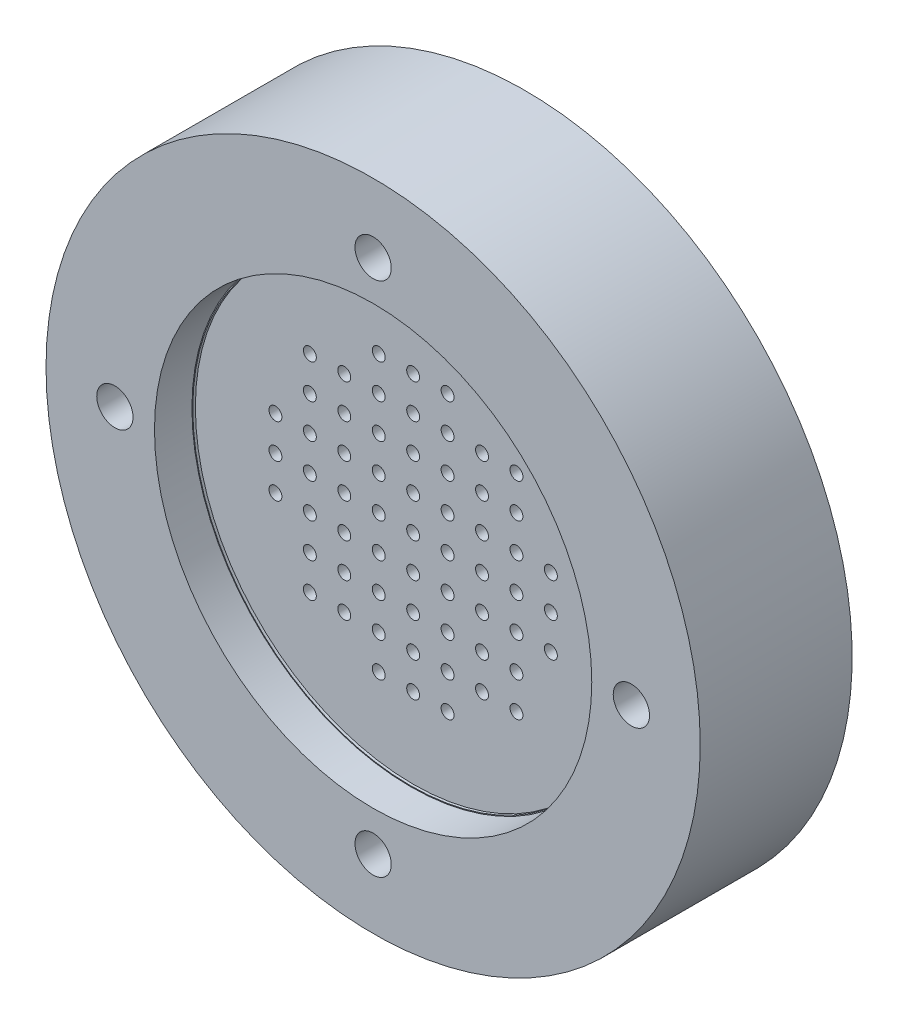
from build123d import *

# Parameters (mm, degrees)
SKETCH1_R                                  = 38
BOSS_EXTRUDE1_DEPTH                        = 5
SKETCH2_R                                  = 0.75
CUT_EXTRUDE1_DEPTH                         = 54.972215074
LPATTERN1_COUNT                            = 5
LPATTERN1_PITCH                            = 4
LPATTERN1_COUNT_DIR2                       = 5
LPATTERN1_PITCH_DIR2                       = 4
MIRROR1_COPY_1_SKETCH_R                    = 0.75
MIRROR1_COPY_1_DEPTH                       = 54.972215074
MIRROR1_COPY_2_SKETCH_R                    = 0.75
MIRROR1_COPY_2_DEPTH                       = 54.972215074
MIRROR1_COPY_3_SKETCH_R                    = 0.75
MIRROR1_COPY_3_DEPTH                       = 54.972215074
MIRROR1_COPY_4_SKETCH_R                    = 0.75
MIRROR1_COPY_4_DEPTH                       = 54.972215074
MIRROR1_COPY_5_SKETCH_R                    = 0.75
MIRROR1_COPY_5_DEPTH                       = 54.972215074
MIRROR1_COPY_6_SKETCH_R                    = 0.75
MIRROR1_COPY_6_DEPTH                       = 54.972215074
MIRROR1_COPY_7_SKETCH_R                    = 0.75
MIRROR1_COPY_7_DEPTH                       = 54.972215074
MIRROR1_COPY_8_SKETCH_R                    = 0.75
MIRROR1_COPY_8_DEPTH                       = 54.972215074
MIRROR1_COPY_9_SKETCH_R                    = 0.75
MIRROR1_COPY_9_DEPTH                       = 54.972215074
MIRROR1_COPY_10_SKETCH_R                   = 0.75
MIRROR1_COPY_10_DEPTH                      = 54.972215074
MIRROR1_COPY_11_SKETCH_R                   = 0.75
MIRROR1_COPY_11_DEPTH                      = 54.972215074
MIRROR1_COPY_12_SKETCH_R                   = 0.75
MIRROR1_COPY_12_DEPTH                      = 54.972215074
MIRROR1_COPY_13_SKETCH_R                   = 0.75
MIRROR1_COPY_13_DEPTH                      = 54.972215074
MIRROR1_COPY_14_SKETCH_R                   = 0.75
MIRROR1_COPY_14_DEPTH                      = 54.972215074
MIRROR1_COPY_15_SKETCH_R                   = 0.75
MIRROR1_COPY_15_DEPTH                      = 54.972215074
MIRROR1_COPY_16_SKETCH_R                   = 0.75
MIRROR1_COPY_16_DEPTH                      = 54.972215074
MIRROR1_COPY_17_SKETCH_R                   = 0.75
MIRROR1_COPY_17_DEPTH                      = 54.972215074
MIRROR1_COPY_18_SKETCH_R                   = 0.75
MIRROR1_COPY_18_DEPTH                      = 54.972215074
MIRROR1_COPY_19_SKETCH_R                   = 0.75
MIRROR1_COPY_19_DEPTH                      = 54.972215074
MIRROR1_COPY_20_SKETCH_R                   = 0.75
MIRROR1_COPY_20_DEPTH                      = 54.972215074
MIRROR1_AT_THE_SECOND_PLANE_COPY_1_SKETC_R = 0.75
MIRROR1_AT_THE_SECOND_PLANE_COPY_1_DEPTH   = 54.972215074
MIRROR1_AT_THE_SECOND_PLANE_COPY_2_SKETC_R = 0.75
MIRROR1_AT_THE_SECOND_PLANE_COPY_2_DEPTH   = 54.972215074
MIRROR1_AT_THE_SECOND_PLANE_COPY_3_SKETC_R = 0.75
MIRROR1_AT_THE_SECOND_PLANE_COPY_3_DEPTH   = 54.972215074
MIRROR1_AT_THE_SECOND_PLANE_COPY_4_SKETC_R = 0.75
MIRROR1_AT_THE_SECOND_PLANE_COPY_4_DEPTH   = 54.972215074
MIRROR1_AT_THE_SECOND_PLANE_COPY_5_SKETC_R = 0.75
MIRROR1_AT_THE_SECOND_PLANE_COPY_5_DEPTH   = 54.972215074
MIRROR1_AT_THE_SECOND_PLANE_COPY_6_SKETC_R = 0.75
MIRROR1_AT_THE_SECOND_PLANE_COPY_6_DEPTH   = 54.972215074
MIRROR1_AT_THE_SECOND_PLANE_COPY_7_SKETC_R = 0.75
MIRROR1_AT_THE_SECOND_PLANE_COPY_7_DEPTH   = 54.972215074
MIRROR1_AT_THE_SECOND_PLANE_COPY_8_SKETC_R = 0.75
MIRROR1_AT_THE_SECOND_PLANE_COPY_8_DEPTH   = 54.972215074
MIRROR1_AT_THE_SECOND_PLANE_COPY_9_SKETC_R = 0.75
MIRROR1_AT_THE_SECOND_PLANE_COPY_9_DEPTH   = 54.972215074
MIRROR1_AT_THE_SECOND_PLANE_COPY_10_SKET_R = 0.75
MIRROR1_AT_THE_SECOND_PLANE_COPY_10_DEPTH  = 54.972215074
MIRROR1_AT_THE_SECOND_PLANE_COPY_11_SKET_R = 0.75
MIRROR1_AT_THE_SECOND_PLANE_COPY_11_DEPTH  = 54.972215074
MIRROR1_AT_THE_SECOND_PLANE_COPY_12_SKET_R = 0.75
MIRROR1_AT_THE_SECOND_PLANE_COPY_12_DEPTH  = 54.972215074
MIRROR1_AT_THE_SECOND_PLANE_COPY_13_SKET_R = 0.75
MIRROR1_AT_THE_SECOND_PLANE_COPY_13_DEPTH  = 54.972215074
MIRROR1_AT_THE_SECOND_PLANE_COPY_14_SKET_R = 0.75
MIRROR1_AT_THE_SECOND_PLANE_COPY_14_DEPTH  = 54.972215074
MIRROR1_AT_THE_SECOND_PLANE_COPY_15_SKET_R = 0.75
MIRROR1_AT_THE_SECOND_PLANE_COPY_15_DEPTH  = 54.972215074
MIRROR1_AT_THE_SECOND_PLANE_COPY_16_SKET_R = 0.75
MIRROR1_AT_THE_SECOND_PLANE_COPY_16_DEPTH  = 54.972215074
MIRROR1_AT_THE_SECOND_PLANE_COPY_17_SKET_R = 0.75
MIRROR1_AT_THE_SECOND_PLANE_COPY_17_DEPTH  = 54.972215074
MIRROR1_AT_THE_SECOND_PLANE_COPY_18_SKET_R = 0.75
MIRROR1_AT_THE_SECOND_PLANE_COPY_18_DEPTH  = 54.972215074
MIRROR1_AT_THE_SECOND_PLANE_COPY_19_SKET_R = 0.75
MIRROR1_AT_THE_SECOND_PLANE_COPY_19_DEPTH  = 54.972215074
MIRROR1_AT_THE_SECOND_PLANE_COPY_20_SKET_R = 0.75
MIRROR1_AT_THE_SECOND_PLANE_COPY_20_DEPTH  = 54.972215074
MIRROR1_AT_THE_SECOND_PLANE_COPY_21_SKET_R = 0.75
MIRROR1_AT_THE_SECOND_PLANE_COPY_21_DEPTH  = 54.972215074
MIRROR1_AT_THE_SECOND_PLANE_COPY_22_SKET_R = 0.75
MIRROR1_AT_THE_SECOND_PLANE_COPY_22_DEPTH  = 54.972215074
MIRROR1_AT_THE_SECOND_PLANE_COPY_23_SKET_R = 0.75
MIRROR1_AT_THE_SECOND_PLANE_COPY_23_DEPTH  = 54.972215074
MIRROR1_AT_THE_SECOND_PLANE_COPY_24_SKET_R = 0.75
MIRROR1_AT_THE_SECOND_PLANE_COPY_24_DEPTH  = 54.972215074
MIRROR1_AT_THE_SECOND_PLANE_COPY_25_SKET_R = 0.75
MIRROR1_AT_THE_SECOND_PLANE_COPY_25_DEPTH  = 54.972215074
MIRROR1_AT_THE_SECOND_PLANE_COPY_26_SKET_R = 0.75
MIRROR1_AT_THE_SECOND_PLANE_COPY_26_DEPTH  = 54.972215074
MIRROR1_AT_THE_SECOND_PLANE_COPY_27_SKET_R = 0.75
MIRROR1_AT_THE_SECOND_PLANE_COPY_27_DEPTH  = 54.972215074
MIRROR1_AT_THE_SECOND_PLANE_COPY_28_SKET_R = 0.75
MIRROR1_AT_THE_SECOND_PLANE_COPY_28_DEPTH  = 54.972215074
MIRROR1_AT_THE_SECOND_PLANE_COPY_29_SKET_R = 0.75
MIRROR1_AT_THE_SECOND_PLANE_COPY_29_DEPTH  = 54.972215074
MIRROR1_AT_THE_SECOND_PLANE_COPY_30_SKET_R = 0.75
MIRROR1_AT_THE_SECOND_PLANE_COPY_30_DEPTH  = 54.972215074
MIRROR1_AT_THE_SECOND_PLANE_COPY_31_SKET_R = 0.75
MIRROR1_AT_THE_SECOND_PLANE_COPY_31_DEPTH  = 54.972215074
MIRROR1_AT_THE_SECOND_PLANE_COPY_32_SKET_R = 0.75
MIRROR1_AT_THE_SECOND_PLANE_COPY_32_DEPTH  = 54.972215074
MIRROR1_AT_THE_SECOND_PLANE_COPY_33_SKET_R = 0.75
MIRROR1_AT_THE_SECOND_PLANE_COPY_33_DEPTH  = 54.972215074
MIRROR1_AT_THE_SECOND_PLANE_COPY_34_SKET_R = 0.75
MIRROR1_AT_THE_SECOND_PLANE_COPY_34_DEPTH  = 54.972215074
MIRROR1_AT_THE_SECOND_PLANE_COPY_35_SKET_R = 0.75
MIRROR1_AT_THE_SECOND_PLANE_COPY_35_DEPTH  = 54.972215074
MIRROR1_AT_THE_SECOND_PLANE_COPY_36_SKET_R = 0.75
MIRROR1_AT_THE_SECOND_PLANE_COPY_36_DEPTH  = 54.972215074
MIRROR1_AT_THE_SECOND_PLANE_COPY_37_SKET_R = 0.75
MIRROR1_AT_THE_SECOND_PLANE_COPY_37_DEPTH  = 54.972215074
MIRROR1_AT_THE_SECOND_PLANE_COPY_38_SKET_R = 0.75
MIRROR1_AT_THE_SECOND_PLANE_COPY_38_DEPTH  = 54.972215074
MIRROR1_AT_THE_SECOND_PLANE_COPY_39_SKET_R = 0.75
MIRROR1_AT_THE_SECOND_PLANE_COPY_39_DEPTH  = 54.972215074
MIRROR1_AT_THE_SECOND_PLANE_COPY_40_SKET_R = 0.75
MIRROR1_AT_THE_SECOND_PLANE_COPY_40_DEPTH  = 54.972215074
MIRROR1_AT_THE_SECOND_PLANE_COPY_41_SKET_R = 0.75
MIRROR1_AT_THE_SECOND_PLANE_COPY_41_DEPTH  = 54.972215074
SKETCH16_R                                 = 38
SKETCH16_R_2                               = 25.4
BOSS_EXTRUDE2_DEPTH                        = 4.65
BOSS_EXTRUDE3_START                        = 8
SKETCH17_R                                 = 38
SKETCH17_R_2                               = 33
BOSS_EXTRUDE3_DEPTH                        = 8
HOLE_FOR_4_300_SC_NUTS_SP_3_D              = 4.2164
CIRPATTERN1_COUNT                          = 4
CIRPATTERN2_COUNT                          = 3
SKETCH43_R                                 = 26.3
SKETCH43_R_2                               = 25.3
BOSS_EXTRUDE4_DEPTH                        = 0.3


with BuildPart() as part:
    # Sketch1 → Boss-Extrude1 (new body)
    with BuildSketch(Plane.XY):
        Circle(SKETCH1_R)
    extrude(amount=BOSS_EXTRUDE1_DEPTH)

    # Sketch2 → Cut-Extrude1 (cut, through all)
    with BuildSketch(Plane.XY.offset(5)):
        Circle(SKETCH2_R)
    cut_extrude1 = extrude(amount=-CUT_EXTRUDE1_DEPTH, mode=Mode.SUBTRACT)

    # LPattern1: Cut-Extrude1 5 × 5, 5 skipped
    with Locations(*[(j * LPATTERN1_PITCH_DIR2, i * LPATTERN1_PITCH, 0) for i in range(LPATTERN1_COUNT) for j in range(LPATTERN1_COUNT_DIR2) if (i, j) not in ((0, 0), (2, 4), (3, 4), (4, 2), (4, 3), (4, 4))]):
        add(cut_extrude1, mode=Mode.SUBTRACT)

    # Mirror1 copy 1 sketch → Mirror1 copy 1 (cut, through all)
    with BuildSketch(Plane(origin=(-4, 0, 5), x_dir=(-1, 0, 0), z_dir=(0, 0, 1))):
        Circle(MIRROR1_COPY_1_SKETCH_R)
    extrude(amount=-MIRROR1_COPY_1_DEPTH, mode=Mode.SUBTRACT)

    # Mirror1 copy 2 sketch → Mirror1 copy 2 (cut, through all)
    with BuildSketch(Plane(origin=(-8, 0, 5), x_dir=(-1, 0, 0), z_dir=(0, 0, 1))):
        Circle(MIRROR1_COPY_2_SKETCH_R)
    extrude(amount=-MIRROR1_COPY_2_DEPTH, mode=Mode.SUBTRACT)

    # Mirror1 copy 3 sketch → Mirror1 copy 3 (cut, through all)
    with BuildSketch(Plane(origin=(-12, 0, 5), x_dir=(-1, 0, 0), z_dir=(0, 0, 1))):
        Circle(MIRROR1_COPY_3_SKETCH_R)
    extrude(amount=-MIRROR1_COPY_3_DEPTH, mode=Mode.SUBTRACT)

    # Mirror1 copy 4 sketch → Mirror1 copy 4 (cut, through all)
    with BuildSketch(Plane(origin=(-16, 0, 5), x_dir=(-1, 0, 0), z_dir=(0, 0, 1))):
        Circle(MIRROR1_COPY_4_SKETCH_R)
    extrude(amount=-MIRROR1_COPY_4_DEPTH, mode=Mode.SUBTRACT)

    # Mirror1 copy 5 sketch → Mirror1 copy 5 (cut, through all)
    with BuildSketch(Plane(origin=(0, 4, 5), x_dir=(-1, 0, 0), z_dir=(0, 0, 1))):
        Circle(MIRROR1_COPY_5_SKETCH_R)
    extrude(amount=-MIRROR1_COPY_5_DEPTH, mode=Mode.SUBTRACT)

    # Mirror1 copy 6 sketch → Mirror1 copy 6 (cut, through all)
    with BuildSketch(Plane(origin=(-4, 4, 5), x_dir=(-1, 0, 0), z_dir=(0, 0, 1))):
        Circle(MIRROR1_COPY_6_SKETCH_R)
    extrude(amount=-MIRROR1_COPY_6_DEPTH, mode=Mode.SUBTRACT)

    # Mirror1 copy 7 sketch → Mirror1 copy 7 (cut, through all)
    with BuildSketch(Plane(origin=(-8, 4, 5), x_dir=(-1, 0, 0), z_dir=(0, 0, 1))):
        Circle(MIRROR1_COPY_7_SKETCH_R)
    extrude(amount=-MIRROR1_COPY_7_DEPTH, mode=Mode.SUBTRACT)

    # Mirror1 copy 8 sketch → Mirror1 copy 8 (cut, through all)
    with BuildSketch(Plane(origin=(-12, 4, 5), x_dir=(-1, 0, 0), z_dir=(0, 0, 1))):
        Circle(MIRROR1_COPY_8_SKETCH_R)
    extrude(amount=-MIRROR1_COPY_8_DEPTH, mode=Mode.SUBTRACT)

    # Mirror1 copy 9 sketch → Mirror1 copy 9 (cut, through all)
    with BuildSketch(Plane(origin=(-16, 4, 5), x_dir=(-1, 0, 0), z_dir=(0, 0, 1))):
        Circle(MIRROR1_COPY_9_SKETCH_R)
    extrude(amount=-MIRROR1_COPY_9_DEPTH, mode=Mode.SUBTRACT)

    # Mirror1 copy 10 sketch → Mirror1 copy 10 (cut, through all)
    with BuildSketch(Plane(origin=(0, 8, 5), x_dir=(-1, 0, 0), z_dir=(0, 0, 1))):
        Circle(MIRROR1_COPY_10_SKETCH_R)
    extrude(amount=-MIRROR1_COPY_10_DEPTH, mode=Mode.SUBTRACT)

    # Mirror1 copy 11 sketch → Mirror1 copy 11 (cut, through all)
    with BuildSketch(Plane(origin=(-4, 8, 5), x_dir=(-1, 0, 0), z_dir=(0, 0, 1))):
        Circle(MIRROR1_COPY_11_SKETCH_R)
    extrude(amount=-MIRROR1_COPY_11_DEPTH, mode=Mode.SUBTRACT)

    # Mirror1 copy 12 sketch → Mirror1 copy 12 (cut, through all)
    with BuildSketch(Plane(origin=(-8, 8, 5), x_dir=(-1, 0, 0), z_dir=(0, 0, 1))):
        Circle(MIRROR1_COPY_12_SKETCH_R)
    extrude(amount=-MIRROR1_COPY_12_DEPTH, mode=Mode.SUBTRACT)

    # Mirror1 copy 13 sketch → Mirror1 copy 13 (cut, through all)
    with BuildSketch(Plane(origin=(-12, 8, 5), x_dir=(-1, 0, 0), z_dir=(0, 0, 1))):
        Circle(MIRROR1_COPY_13_SKETCH_R)
    extrude(amount=-MIRROR1_COPY_13_DEPTH, mode=Mode.SUBTRACT)

    # Mirror1 copy 14 sketch → Mirror1 copy 14 (cut, through all)
    with BuildSketch(Plane(origin=(0, 12, 5), x_dir=(-1, 0, 0), z_dir=(0, 0, 1))):
        Circle(MIRROR1_COPY_14_SKETCH_R)
    extrude(amount=-MIRROR1_COPY_14_DEPTH, mode=Mode.SUBTRACT)

    # Mirror1 copy 15 sketch → Mirror1 copy 15 (cut, through all)
    with BuildSketch(Plane(origin=(-4, 12, 5), x_dir=(-1, 0, 0), z_dir=(0, 0, 1))):
        Circle(MIRROR1_COPY_15_SKETCH_R)
    extrude(amount=-MIRROR1_COPY_15_DEPTH, mode=Mode.SUBTRACT)

    # Mirror1 copy 16 sketch → Mirror1 copy 16 (cut, through all)
    with BuildSketch(Plane(origin=(-8, 12, 5), x_dir=(-1, 0, 0), z_dir=(0, 0, 1))):
        Circle(MIRROR1_COPY_16_SKETCH_R)
    extrude(amount=-MIRROR1_COPY_16_DEPTH, mode=Mode.SUBTRACT)

    # Mirror1 copy 17 sketch → Mirror1 copy 17 (cut, through all)
    with BuildSketch(Plane(origin=(-12, 12, 5), x_dir=(-1, 0, 0), z_dir=(0, 0, 1))):
        Circle(MIRROR1_COPY_17_SKETCH_R)
    extrude(amount=-MIRROR1_COPY_17_DEPTH, mode=Mode.SUBTRACT)

    # Mirror1 copy 18 sketch → Mirror1 copy 18 (cut, through all)
    with BuildSketch(Plane(origin=(0, 16, 5), x_dir=(-1, 0, 0), z_dir=(0, 0, 1))):
        Circle(MIRROR1_COPY_18_SKETCH_R)
    extrude(amount=-MIRROR1_COPY_18_DEPTH, mode=Mode.SUBTRACT)

    # Mirror1 copy 19 sketch → Mirror1 copy 19 (cut, through all)
    with BuildSketch(Plane(origin=(-4, 16, 5), x_dir=(-1, 0, 0), z_dir=(0, 0, 1))):
        Circle(MIRROR1_COPY_19_SKETCH_R)
    extrude(amount=-MIRROR1_COPY_19_DEPTH, mode=Mode.SUBTRACT)

    # Mirror1 copy 20 sketch → Mirror1 copy 20 (cut, through all)
    with BuildSketch(Plane(origin=(0, 0, 5), x_dir=(-1, 0, 0), z_dir=(0, 0, 1))):
        Circle(MIRROR1_COPY_20_SKETCH_R)
    extrude(amount=-MIRROR1_COPY_20_DEPTH, mode=Mode.SUBTRACT)

    # Mirror1 at the second plane copy 1 sketc → Mirror1 at the second plane copy 1 (cut, through all)
    with BuildSketch(Plane(origin=(4, 0, 5), x_dir=(1, 0, 0), z_dir=(0, 0, 1))):
        Circle(MIRROR1_AT_THE_SECOND_PLANE_COPY_1_SKETC_R)
    extrude(amount=-MIRROR1_AT_THE_SECOND_PLANE_COPY_1_DEPTH, mode=Mode.SUBTRACT)

    # Mirror1 at the second plane copy 2 sketc → Mirror1 at the second plane copy 2 (cut, through all)
    with BuildSketch(Plane(origin=(8, 0, 5), x_dir=(1, 0, 0), z_dir=(0, 0, 1))):
        Circle(MIRROR1_AT_THE_SECOND_PLANE_COPY_2_SKETC_R)
    extrude(amount=-MIRROR1_AT_THE_SECOND_PLANE_COPY_2_DEPTH, mode=Mode.SUBTRACT)

    # Mirror1 at the second plane copy 3 sketc → Mirror1 at the second plane copy 3 (cut, through all)
    with BuildSketch(Plane(origin=(12, 0, 5), x_dir=(1, 0, 0), z_dir=(0, 0, 1))):
        Circle(MIRROR1_AT_THE_SECOND_PLANE_COPY_3_SKETC_R)
    extrude(amount=-MIRROR1_AT_THE_SECOND_PLANE_COPY_3_DEPTH, mode=Mode.SUBTRACT)

    # Mirror1 at the second plane copy 4 sketc → Mirror1 at the second plane copy 4 (cut, through all)
    with BuildSketch(Plane(origin=(16, 0, 5), x_dir=(1, 0, 0), z_dir=(0, 0, 1))):
        Circle(MIRROR1_AT_THE_SECOND_PLANE_COPY_4_SKETC_R)
    extrude(amount=-MIRROR1_AT_THE_SECOND_PLANE_COPY_4_DEPTH, mode=Mode.SUBTRACT)

    # Mirror1 at the second plane copy 5 sketc → Mirror1 at the second plane copy 5 (cut, through all)
    with BuildSketch(Plane(origin=(0, -4, 5), x_dir=(1, 0, 0), z_dir=(0, 0, 1))):
        Circle(MIRROR1_AT_THE_SECOND_PLANE_COPY_5_SKETC_R)
    extrude(amount=-MIRROR1_AT_THE_SECOND_PLANE_COPY_5_DEPTH, mode=Mode.SUBTRACT)

    # Mirror1 at the second plane copy 6 sketc → Mirror1 at the second plane copy 6 (cut, through all)
    with BuildSketch(Plane(origin=(4, -4, 5), x_dir=(1, 0, 0), z_dir=(0, 0, 1))):
        Circle(MIRROR1_AT_THE_SECOND_PLANE_COPY_6_SKETC_R)
    extrude(amount=-MIRROR1_AT_THE_SECOND_PLANE_COPY_6_DEPTH, mode=Mode.SUBTRACT)

    # Mirror1 at the second plane copy 7 sketc → Mirror1 at the second plane copy 7 (cut, through all)
    with BuildSketch(Plane(origin=(8, -4, 5), x_dir=(1, 0, 0), z_dir=(0, 0, 1))):
        Circle(MIRROR1_AT_THE_SECOND_PLANE_COPY_7_SKETC_R)
    extrude(amount=-MIRROR1_AT_THE_SECOND_PLANE_COPY_7_DEPTH, mode=Mode.SUBTRACT)

    # Mirror1 at the second plane copy 8 sketc → Mirror1 at the second plane copy 8 (cut, through all)
    with BuildSketch(Plane(origin=(12, -4, 5), x_dir=(1, 0, 0), z_dir=(0, 0, 1))):
        Circle(MIRROR1_AT_THE_SECOND_PLANE_COPY_8_SKETC_R)
    extrude(amount=-MIRROR1_AT_THE_SECOND_PLANE_COPY_8_DEPTH, mode=Mode.SUBTRACT)

    # Mirror1 at the second plane copy 9 sketc → Mirror1 at the second plane copy 9 (cut, through all)
    with BuildSketch(Plane(origin=(16, -4, 5), x_dir=(1, 0, 0), z_dir=(0, 0, 1))):
        Circle(MIRROR1_AT_THE_SECOND_PLANE_COPY_9_SKETC_R)
    extrude(amount=-MIRROR1_AT_THE_SECOND_PLANE_COPY_9_DEPTH, mode=Mode.SUBTRACT)

    # Mirror1 at the second plane copy 10 sket → Mirror1 at the second plane copy 10 (cut, through all)
    with BuildSketch(Plane(origin=(0, -8, 5), x_dir=(1, 0, 0), z_dir=(0, 0, 1))):
        Circle(MIRROR1_AT_THE_SECOND_PLANE_COPY_10_SKET_R)
    extrude(amount=-MIRROR1_AT_THE_SECOND_PLANE_COPY_10_DEPTH, mode=Mode.SUBTRACT)

    # Mirror1 at the second plane copy 11 sket → Mirror1 at the second plane copy 11 (cut, through all)
    with BuildSketch(Plane(origin=(4, -8, 5), x_dir=(1, 0, 0), z_dir=(0, 0, 1))):
        Circle(MIRROR1_AT_THE_SECOND_PLANE_COPY_11_SKET_R)
    extrude(amount=-MIRROR1_AT_THE_SECOND_PLANE_COPY_11_DEPTH, mode=Mode.SUBTRACT)

    # Mirror1 at the second plane copy 12 sket → Mirror1 at the second plane copy 12 (cut, through all)
    with BuildSketch(Plane(origin=(8, -8, 5), x_dir=(1, 0, 0), z_dir=(0, 0, 1))):
        Circle(MIRROR1_AT_THE_SECOND_PLANE_COPY_12_SKET_R)
    extrude(amount=-MIRROR1_AT_THE_SECOND_PLANE_COPY_12_DEPTH, mode=Mode.SUBTRACT)

    # Mirror1 at the second plane copy 13 sket → Mirror1 at the second plane copy 13 (cut, through all)
    with BuildSketch(Plane(origin=(12, -8, 5), x_dir=(1, 0, 0), z_dir=(0, 0, 1))):
        Circle(MIRROR1_AT_THE_SECOND_PLANE_COPY_13_SKET_R)
    extrude(amount=-MIRROR1_AT_THE_SECOND_PLANE_COPY_13_DEPTH, mode=Mode.SUBTRACT)

    # Mirror1 at the second plane copy 14 sket → Mirror1 at the second plane copy 14 (cut, through all)
    with BuildSketch(Plane(origin=(0, -12, 5), x_dir=(1, 0, 0), z_dir=(0, 0, 1))):
        Circle(MIRROR1_AT_THE_SECOND_PLANE_COPY_14_SKET_R)
    extrude(amount=-MIRROR1_AT_THE_SECOND_PLANE_COPY_14_DEPTH, mode=Mode.SUBTRACT)

    # Mirror1 at the second plane copy 15 sket → Mirror1 at the second plane copy 15 (cut, through all)
    with BuildSketch(Plane(origin=(4, -12, 5), x_dir=(1, 0, 0), z_dir=(0, 0, 1))):
        Circle(MIRROR1_AT_THE_SECOND_PLANE_COPY_15_SKET_R)
    extrude(amount=-MIRROR1_AT_THE_SECOND_PLANE_COPY_15_DEPTH, mode=Mode.SUBTRACT)

    # Mirror1 at the second plane copy 16 sket → Mirror1 at the second plane copy 16 (cut, through all)
    with BuildSketch(Plane(origin=(8, -12, 5), x_dir=(1, 0, 0), z_dir=(0, 0, 1))):
        Circle(MIRROR1_AT_THE_SECOND_PLANE_COPY_16_SKET_R)
    extrude(amount=-MIRROR1_AT_THE_SECOND_PLANE_COPY_16_DEPTH, mode=Mode.SUBTRACT)

    # Mirror1 at the second plane copy 17 sket → Mirror1 at the second plane copy 17 (cut, through all)
    with BuildSketch(Plane(origin=(12, -12, 5), x_dir=(1, 0, 0), z_dir=(0, 0, 1))):
        Circle(MIRROR1_AT_THE_SECOND_PLANE_COPY_17_SKET_R)
    extrude(amount=-MIRROR1_AT_THE_SECOND_PLANE_COPY_17_DEPTH, mode=Mode.SUBTRACT)

    # Mirror1 at the second plane copy 18 sket → Mirror1 at the second plane copy 18 (cut, through all)
    with BuildSketch(Plane(origin=(0, -16, 5), x_dir=(1, 0, 0), z_dir=(0, 0, 1))):
        Circle(MIRROR1_AT_THE_SECOND_PLANE_COPY_18_SKET_R)
    extrude(amount=-MIRROR1_AT_THE_SECOND_PLANE_COPY_18_DEPTH, mode=Mode.SUBTRACT)

    # Mirror1 at the second plane copy 19 sket → Mirror1 at the second plane copy 19 (cut, through all)
    with BuildSketch(Plane(origin=(4, -16, 5), x_dir=(1, 0, 0), z_dir=(0, 0, 1))):
        Circle(MIRROR1_AT_THE_SECOND_PLANE_COPY_19_SKET_R)
    extrude(amount=-MIRROR1_AT_THE_SECOND_PLANE_COPY_19_DEPTH, mode=Mode.SUBTRACT)

    # Mirror1 at the second plane copy 20 sket → Mirror1 at the second plane copy 20 (cut, through all)
    with BuildSketch(Plane.XY.offset(5)):
        Circle(MIRROR1_AT_THE_SECOND_PLANE_COPY_20_SKET_R)
    extrude(amount=-MIRROR1_AT_THE_SECOND_PLANE_COPY_20_DEPTH, mode=Mode.SUBTRACT)

    # Mirror1 at the second plane copy 21 sket → Mirror1 at the second plane copy 21 (cut, through all)
    with BuildSketch(Plane(origin=(-4, 0, 5), x_dir=(-1, 0, 0), z_dir=(0, 0, 1))):
        Circle(MIRROR1_AT_THE_SECOND_PLANE_COPY_21_SKET_R)
    extrude(amount=-MIRROR1_AT_THE_SECOND_PLANE_COPY_21_DEPTH, mode=Mode.SUBTRACT)

    # Mirror1 at the second plane copy 22 sket → Mirror1 at the second plane copy 22 (cut, through all)
    with BuildSketch(Plane(origin=(-8, 0, 5), x_dir=(-1, 0, 0), z_dir=(0, 0, 1))):
        Circle(MIRROR1_AT_THE_SECOND_PLANE_COPY_22_SKET_R)
    extrude(amount=-MIRROR1_AT_THE_SECOND_PLANE_COPY_22_DEPTH, mode=Mode.SUBTRACT)

    # Mirror1 at the second plane copy 23 sket → Mirror1 at the second plane copy 23 (cut, through all)
    with BuildSketch(Plane(origin=(-12, 0, 5), x_dir=(-1, 0, 0), z_dir=(0, 0, 1))):
        Circle(MIRROR1_AT_THE_SECOND_PLANE_COPY_23_SKET_R)
    extrude(amount=-MIRROR1_AT_THE_SECOND_PLANE_COPY_23_DEPTH, mode=Mode.SUBTRACT)

    # Mirror1 at the second plane copy 24 sket → Mirror1 at the second plane copy 24 (cut, through all)
    with BuildSketch(Plane(origin=(-16, 0, 5), x_dir=(-1, 0, 0), z_dir=(0, 0, 1))):
        Circle(MIRROR1_AT_THE_SECOND_PLANE_COPY_24_SKET_R)
    extrude(amount=-MIRROR1_AT_THE_SECOND_PLANE_COPY_24_DEPTH, mode=Mode.SUBTRACT)

    # Mirror1 at the second plane copy 25 sket → Mirror1 at the second plane copy 25 (cut, through all)
    with BuildSketch(Plane(origin=(0, -4, 5), x_dir=(-1, 0, 0), z_dir=(0, 0, 1))):
        Circle(MIRROR1_AT_THE_SECOND_PLANE_COPY_25_SKET_R)
    extrude(amount=-MIRROR1_AT_THE_SECOND_PLANE_COPY_25_DEPTH, mode=Mode.SUBTRACT)

    # Mirror1 at the second plane copy 26 sket → Mirror1 at the second plane copy 26 (cut, through all)
    with BuildSketch(Plane(origin=(-4, -4, 5), x_dir=(-1, 0, 0), z_dir=(0, 0, 1))):
        Circle(MIRROR1_AT_THE_SECOND_PLANE_COPY_26_SKET_R)
    extrude(amount=-MIRROR1_AT_THE_SECOND_PLANE_COPY_26_DEPTH, mode=Mode.SUBTRACT)

    # Mirror1 at the second plane copy 27 sket → Mirror1 at the second plane copy 27 (cut, through all)
    with BuildSketch(Plane(origin=(-8, -4, 5), x_dir=(-1, 0, 0), z_dir=(0, 0, 1))):
        Circle(MIRROR1_AT_THE_SECOND_PLANE_COPY_27_SKET_R)
    extrude(amount=-MIRROR1_AT_THE_SECOND_PLANE_COPY_27_DEPTH, mode=Mode.SUBTRACT)

    # Mirror1 at the second plane copy 28 sket → Mirror1 at the second plane copy 28 (cut, through all)
    with BuildSketch(Plane(origin=(-12, -4, 5), x_dir=(-1, 0, 0), z_dir=(0, 0, 1))):
        Circle(MIRROR1_AT_THE_SECOND_PLANE_COPY_28_SKET_R)
    extrude(amount=-MIRROR1_AT_THE_SECOND_PLANE_COPY_28_DEPTH, mode=Mode.SUBTRACT)

    # Mirror1 at the second plane copy 29 sket → Mirror1 at the second plane copy 29 (cut, through all)
    with BuildSketch(Plane(origin=(-16, -4, 5), x_dir=(-1, 0, 0), z_dir=(0, 0, 1))):
        Circle(MIRROR1_AT_THE_SECOND_PLANE_COPY_29_SKET_R)
    extrude(amount=-MIRROR1_AT_THE_SECOND_PLANE_COPY_29_DEPTH, mode=Mode.SUBTRACT)

    # Mirror1 at the second plane copy 30 sket → Mirror1 at the second plane copy 30 (cut, through all)
    with BuildSketch(Plane(origin=(0, -8, 5), x_dir=(-1, 0, 0), z_dir=(0, 0, 1))):
        Circle(MIRROR1_AT_THE_SECOND_PLANE_COPY_30_SKET_R)
    extrude(amount=-MIRROR1_AT_THE_SECOND_PLANE_COPY_30_DEPTH, mode=Mode.SUBTRACT)

    # Mirror1 at the second plane copy 31 sket → Mirror1 at the second plane copy 31 (cut, through all)
    with BuildSketch(Plane(origin=(-4, -8, 5), x_dir=(-1, 0, 0), z_dir=(0, 0, 1))):
        Circle(MIRROR1_AT_THE_SECOND_PLANE_COPY_31_SKET_R)
    extrude(amount=-MIRROR1_AT_THE_SECOND_PLANE_COPY_31_DEPTH, mode=Mode.SUBTRACT)

    # Mirror1 at the second plane copy 32 sket → Mirror1 at the second plane copy 32 (cut, through all)
    with BuildSketch(Plane(origin=(-8, -8, 5), x_dir=(-1, 0, 0), z_dir=(0, 0, 1))):
        Circle(MIRROR1_AT_THE_SECOND_PLANE_COPY_32_SKET_R)
    extrude(amount=-MIRROR1_AT_THE_SECOND_PLANE_COPY_32_DEPTH, mode=Mode.SUBTRACT)

    # Mirror1 at the second plane copy 33 sket → Mirror1 at the second plane copy 33 (cut, through all)
    with BuildSketch(Plane(origin=(-12, -8, 5), x_dir=(-1, 0, 0), z_dir=(0, 0, 1))):
        Circle(MIRROR1_AT_THE_SECOND_PLANE_COPY_33_SKET_R)
    extrude(amount=-MIRROR1_AT_THE_SECOND_PLANE_COPY_33_DEPTH, mode=Mode.SUBTRACT)

    # Mirror1 at the second plane copy 34 sket → Mirror1 at the second plane copy 34 (cut, through all)
    with BuildSketch(Plane(origin=(0, -12, 5), x_dir=(-1, 0, 0), z_dir=(0, 0, 1))):
        Circle(MIRROR1_AT_THE_SECOND_PLANE_COPY_34_SKET_R)
    extrude(amount=-MIRROR1_AT_THE_SECOND_PLANE_COPY_34_DEPTH, mode=Mode.SUBTRACT)

    # Mirror1 at the second plane copy 35 sket → Mirror1 at the second plane copy 35 (cut, through all)
    with BuildSketch(Plane(origin=(-4, -12, 5), x_dir=(-1, 0, 0), z_dir=(0, 0, 1))):
        Circle(MIRROR1_AT_THE_SECOND_PLANE_COPY_35_SKET_R)
    extrude(amount=-MIRROR1_AT_THE_SECOND_PLANE_COPY_35_DEPTH, mode=Mode.SUBTRACT)

    # Mirror1 at the second plane copy 36 sket → Mirror1 at the second plane copy 36 (cut, through all)
    with BuildSketch(Plane(origin=(-8, -12, 5), x_dir=(-1, 0, 0), z_dir=(0, 0, 1))):
        Circle(MIRROR1_AT_THE_SECOND_PLANE_COPY_36_SKET_R)
    extrude(amount=-MIRROR1_AT_THE_SECOND_PLANE_COPY_36_DEPTH, mode=Mode.SUBTRACT)

    # Mirror1 at the second plane copy 37 sket → Mirror1 at the second plane copy 37 (cut, through all)
    with BuildSketch(Plane(origin=(-12, -12, 5), x_dir=(-1, 0, 0), z_dir=(0, 0, 1))):
        Circle(MIRROR1_AT_THE_SECOND_PLANE_COPY_37_SKET_R)
    extrude(amount=-MIRROR1_AT_THE_SECOND_PLANE_COPY_37_DEPTH, mode=Mode.SUBTRACT)

    # Mirror1 at the second plane copy 38 sket → Mirror1 at the second plane copy 38 (cut, through all)
    with BuildSketch(Plane(origin=(0, -16, 5), x_dir=(-1, 0, 0), z_dir=(0, 0, 1))):
        Circle(MIRROR1_AT_THE_SECOND_PLANE_COPY_38_SKET_R)
    extrude(amount=-MIRROR1_AT_THE_SECOND_PLANE_COPY_38_DEPTH, mode=Mode.SUBTRACT)

    # Mirror1 at the second plane copy 39 sket → Mirror1 at the second plane copy 39 (cut, through all)
    with BuildSketch(Plane(origin=(-4, -16, 5), x_dir=(-1, 0, 0), z_dir=(0, 0, 1))):
        Circle(MIRROR1_AT_THE_SECOND_PLANE_COPY_39_SKET_R)
    extrude(amount=-MIRROR1_AT_THE_SECOND_PLANE_COPY_39_DEPTH, mode=Mode.SUBTRACT)

    # Mirror1 at the second plane copy 40 sket → Mirror1 at the second plane copy 40 (cut, through all)
    with BuildSketch(Plane(origin=(0, 0, 5), x_dir=(-1, 0, 0), z_dir=(0, 0, 1))):
        Circle(MIRROR1_AT_THE_SECOND_PLANE_COPY_40_SKET_R)
    extrude(amount=-MIRROR1_AT_THE_SECOND_PLANE_COPY_40_DEPTH, mode=Mode.SUBTRACT)

    # Mirror1 at the second plane copy 41 sket → Mirror1 at the second plane copy 41 (cut, through all)
    with BuildSketch(Plane.XY.offset(5)):
        Circle(MIRROR1_AT_THE_SECOND_PLANE_COPY_41_SKET_R)
    extrude(amount=-MIRROR1_AT_THE_SECOND_PLANE_COPY_41_DEPTH, mode=Mode.SUBTRACT)

    # Sketch16 → Boss-Extrude2 (add)
    with BuildSketch(Plane.XY.offset(5)):
        Circle(SKETCH16_R)
        Circle(SKETCH16_R_2, mode=Mode.SUBTRACT)
    extrude(amount=BOSS_EXTRUDE2_DEPTH)

    # Sketch17 → Boss-Extrude3 (add)
    with BuildSketch(Plane(origin=(0, 0, 0), x_dir=(-1, 0, 0), z_dir=(0, 0, -1)).offset(BOSS_EXTRUDE3_START)):
        Circle(SKETCH17_R)
        Circle(SKETCH17_R_2, mode=Mode.SUBTRACT)
    extrude(amount=-BOSS_EXTRUDE3_DEPTH)

    # Hole for #4 300® SC Nuts (SP)3 (through all)
    with Locations(Plane(origin=(0, 0, 0), x_dir=(-1, 0, 0), z_dir=(0, 0, -1))):
        with Locations((0, -30)):
            hole_for_4_300_sc_nuts_sp_3 = Hole(HOLE_FOR_4_300_SC_NUTS_SP_3_D / 2)

    # CirPattern1: Hole for #4 300® SC Nuts (SP)3 ×4 about axis
    cirpattern1_axis = Axis((0, 0, 0), (0, 0, 1))
    for i in range(1, CIRPATTERN1_COUNT):
        add(hole_for_4_300_sc_nuts_sp_3.rotate(cirpattern1_axis, i * 360 / CIRPATTERN1_COUNT), mode=Mode.SUBTRACT)

    # Sketch41 → Hole for #4 300® SC Nuts (SP)4 (revolve, cut)
    with BuildSketch(Plane(origin=(0, -35.5, -8), x_dir=(0, 1, 0), z_dir=(1, 0, 0))):
        Polygon((0, 0), (0, 6.266734357), (2.1082, 5), (2.1082, 0), align=None)
    hole_for_4_300_sc_nuts_sp_4 = revolve(axis=Axis((0, -35.5, -14.35), (0, 0, 1)), mode=Mode.SUBTRACT)

    # CirPattern2: Hole for #4 300® SC Nuts (SP)4 ×3 about axis
    cirpattern2_axis = Axis((0, 0, 0), (0, 0, 1))
    for i in range(1, CIRPATTERN2_COUNT):
        add(hole_for_4_300_sc_nuts_sp_4.rotate(cirpattern2_axis, i * 360 / CIRPATTERN2_COUNT), mode=Mode.SUBTRACT)

    # Sketch43 → Boss-Extrude4 (add)
    with BuildSketch(Plane.XY.offset(5)):
        Circle(SKETCH43_R)
        Circle(SKETCH43_R_2, mode=Mode.SUBTRACT)
    extrude(amount=BOSS_EXTRUDE4_DEPTH)


solid = part.part
